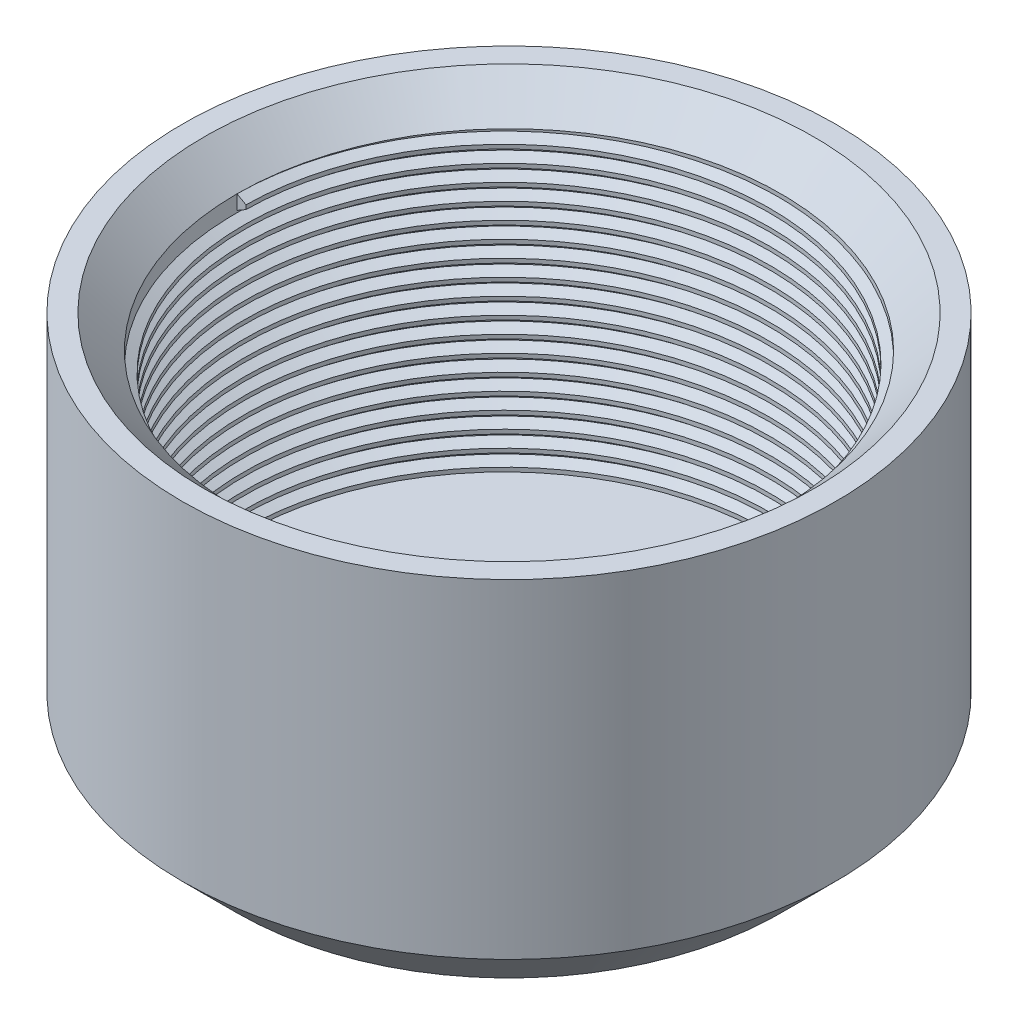
from build123d import *

# Parameters (mm, degrees)
SKETCH1_R           = 29.8
SKETCH1_R_2         = 24.8
BOSS_EXTRUDE1_DEPTH = 30
CHAMFER4_SIZE       = 3
THREAD2_PITCH       = 1.5
BOSS_EXTRUDE2_START = 5
SKETCH2_R           = 29.8
BOSS_EXTRUDE2_DEPTH = 5
CHAMFER1_SIZE       = 5
BOSS_EXTRUDE3_DEPTH = 0.05


with BuildPart() as part:
    # Sketch1 → Boss-Extrude1 (new body)
    with BuildSketch(Plane(origin=(0, 0, 0), x_dir=(1, 0, 0), z_dir=(0, 1, 0))):
        with Locations(Location((0, 0, 0), (0, 0, 270))):
            Circle(SKETCH1_R)
        with Locations(Location((0, 0, 0), (0, 0, 270))):
            Circle(SKETCH1_R_2, mode=Mode.SUBTRACT)
    extrude(amount=BOSS_EXTRUDE1_DEPTH)

    # Chamfer4
    chamfer4_edges = [part.edges().sort_by_distance(p)[0] for p in [
        (0, 30, -24.8),
    ]]
    chamfer(chamfer4_edges, length=CHAMFER4_SIZE)

    # Thread2: the profile of Thread Profile2 profile screwed along a right-hand helix of 20 turns, 8 arcs to a turn; built about Z, then put on its axis
    thread2_z = Axis((0, 0, 0), (0, 0, 1))
    thread2_corners = [(24.8003, 0, -0.000173205), (24.8003, 0, 1.312673201), (23.988101187, 0, 0.843749998), (23.988101187, 0, 0.468749998)]
    with BuildLine(mode=Mode.PRIVATE) as thread2_profile:
        Line(thread2_corners[0], thread2_corners[1])
        Line(thread2_corners[1], thread2_corners[2])
        Line(thread2_corners[2], thread2_corners[3])
        Line(thread2_corners[3], thread2_corners[0])
    thread2_cap = Face(thread2_profile.wire())
    thread2_turn_angles = [0, 22.5, 45, 67.5, 90, 112.5, 135, 157.5, 180, 202.5, 225, 247.5, 270, 292.5, 315, 337.5, 360]
    thread2_turn_weights = [1, 0.9238795325112867, 1, 0.9238795325112867, 1, 0.9238795325112867, 1, 0.9238795325112867, 1, 0.9238795325112867, 1, 0.9238795325112867, 1, 0.9238795325112867, 1, 0.9238795325112867, 1]
    thread2_turn_rails = [Edge.make_bspline([Vector(p[0], p[1], 0).rotate(thread2_z, thread2_turn_angles[k]) / thread2_turn_weights[k] + Vector(0, 0, p[2] + THREAD2_PITCH * thread2_turn_angles[k] / 360) for k in range(17)], [0, 0, 0, 1, 1, 2, 2, 3, 3, 4, 4, 5, 5, 6, 6, 7, 7, 8, 8, 8], 2, thread2_turn_weights) for p in thread2_corners]
    thread2_turn_sides = [Face.make_surface_from_curves(thread2_turn_rails[p[0]], thread2_turn_rails[p[1]]) for p in [(0, 1), (1, 2), (2, 3), (3, 0)]]
    thread2 = Plane(origin=(0, 27, 0), x_dir=(-1, 0, 0), z_dir=(0, -1, 0)) * Solid(Shell([*[p.moved(Location((0, 0, THREAD2_PITCH * i))) for i in range(20) for p in thread2_turn_sides], thread2_cap, thread2_cap.rotate(thread2_z, 7200).moved(Location((0, 0, THREAD2_PITCH * 7200 / 360)))]))
    add(thread2)

    # Sketch2 → Boss-Extrude2 (add)
    with BuildSketch(Plane.XZ.offset(BOSS_EXTRUDE2_START)):
        with Locations(Location((0, 0, 0), (0, 0, 270))):
            Circle(SKETCH2_R)
    extrude(amount=-BOSS_EXTRUDE2_DEPTH)

    # Chamfer1
    chamfer1_edges = [part.edges().sort_by_distance(p)[0] for p in [
        (0, -5, 29.8),
    ]]
    chamfer(chamfer1_edges, length=CHAMFER1_SIZE - 0.0001)  # a hair under: the kernel refuses the full size

    # Sketch3 → Boss-Extrude3 (add)
    with BuildSketch(Plane.XZ.offset(5)):
        with BuildLine():
            Line((-1.094412311, 13.839282251), (1.094412311, 13.839282251))
            Line((1.094412311, 13.839282251), (1.693292838, 11.625744327))
            ThreePointArc((1.693292838, 11.625744327), (3.040712635, 11.348094045), (4.346437549, 10.914836344))
            Line((4.346437549, 10.914836344), (5.971852262, 12.532376155))
            Line((5.971852262, 12.532376155), (7.867429989, 11.437963844))
            Line((7.867429989, 11.437963844), (7.279306777, 9.221543506))
            ThreePointArc((7.279306777, 9.221543506), (8.30738141, 8.30738141), (9.221543506, 7.279306777))
            Line((9.221543506, 7.279306777), (11.437963844, 7.867429989))
            Line((11.437963844, 7.867429989), (12.532376155, 5.971852262))
            Line((12.532376155, 5.971852262), (10.914836344, 4.346437549))
            Line((10.914836344, 4.346437549), (7.397309253, 3.420864776))
            ThreePointArc((7.397309253, 3.420864776), (-0.910350582, 8.098997581), (-7.972155252, 1.693292838))
            Line((-7.972155252, 1.693292838), (-0.293210352, 1.693292838))
            Line((-0.293210352, 1.693292838), (-2.232316656, -1.693292838))
            Line((-2.232316656, -1.693292838), (-11.625744327, -1.693292838))
            Line((-11.625744327, -1.693292838), (-13.839282251, -1.094412311))
            Line((-13.839282251, -1.094412311), (-13.839282251, 1.094412311))
            Line((-13.839282251, 1.094412311), (-11.625744327, 1.693292838))
            ThreePointArc((-11.625744327, 1.693292838), (-11.348094045, 3.040712635), (-10.914836344, 4.346437549))
            Line((-10.914836344, 4.346437549), (-12.532376155, 5.971852262))
            Line((-12.532376155, 5.971852262), (-11.437963844, 7.867429989))
            Line((-11.437963844, 7.867429989), (-9.221543506, 7.279306777))
            ThreePointArc((-9.221543506, 7.279306777), (-8.30738141, 8.30738141), (-7.279306777, 9.221543506))
            Line((-7.279306777, 9.221543506), (-7.867429989, 11.437963844))
            Line((-7.867429989, 11.437963844), (-5.971852262, 12.532376155))
            Line((-5.971852262, 12.532376155), (-4.346437549, 10.914836344))
            ThreePointArc((-4.346437549, 10.914836344), (-3.040712635, 11.348094045), (-1.693292838, 11.625744327))
            Line((-1.693292838, 11.625744327), (-1.094412311, 13.839282251))
        make_face()
        with BuildLine():
            Line((11.625744327, 1.693292838), (1.900654949, 1.693292838))
            Line((1.900654949, 1.693292838), (-0.059323855, -1.693292838))
            Line((-0.059323855, -1.693292838), (7.972155252, -1.693292838))
            ThreePointArc((7.972155252, -1.693292838), (0.898249289, -8.100348648), (-7.407498077, -3.398745687))
            Line((-7.407498077, -3.398745687), (-10.914836344, -4.346437549))
            Line((-10.914836344, -4.346437549), (-12.532376155, -5.971852262))
            Line((-12.532376155, -5.971852262), (-11.437963844, -7.867429989))
            Line((-11.437963844, -7.867429989), (-9.221543506, -7.279306777))
            ThreePointArc((-9.221543506, -7.279306777), (-8.30738141, -8.30738141), (-7.279306777, -9.221543506))
            Line((-7.279306777, -9.221543506), (-7.867429989, -11.437963844))
            Line((-7.867429989, -11.437963844), (-5.971852262, -12.532376155))
            Line((-5.971852262, -12.532376155), (-4.346437549, -10.914836344))
            ThreePointArc((-4.346437549, -10.914836344), (-3.040712635, -11.348094045), (-1.693292838, -11.625744327))
            Line((-1.693292838, -11.625744327), (-1.094412311, -13.839282251))
            Line((-1.094412311, -13.839282251), (1.094412311, -13.839282251))
            Line((1.094412311, -13.839282251), (1.693292838, -11.625744327))
            ThreePointArc((1.693292838, -11.625744327), (3.040712635, -11.348094045), (4.346437549, -10.914836344))
            Line((4.346437549, -10.914836344), (5.971852262, -12.532376155))
            Line((5.971852262, -12.532376155), (7.867429989, -11.437963844))
            Line((7.867429989, -11.437963844), (7.279306777, -9.221543506))
            ThreePointArc((7.279306777, -9.221543506), (8.30738141, -8.30738141), (9.221543506, -7.279306777))
            Line((9.221543506, -7.279306777), (11.437963844, -7.867429989))
            Line((11.437963844, -7.867429989), (12.532376155, -5.971852262))
            Line((12.532376155, -5.971852262), (10.914836344, -4.346437549))
            ThreePointArc((10.914836344, -4.346437549), (11.348094045, -3.040712635), (11.625744327, -1.693292838))
            Line((11.625744327, -1.693292838), (13.839282251, -1.094412311))
            Line((13.839282251, -1.094412311), (13.839282251, 1.094412311))
            Line((13.839282251, 1.094412311), (11.625744327, 1.693292838))
        make_face()
    extrude(amount=BOSS_EXTRUDE3_DEPTH)


solid = part.part
